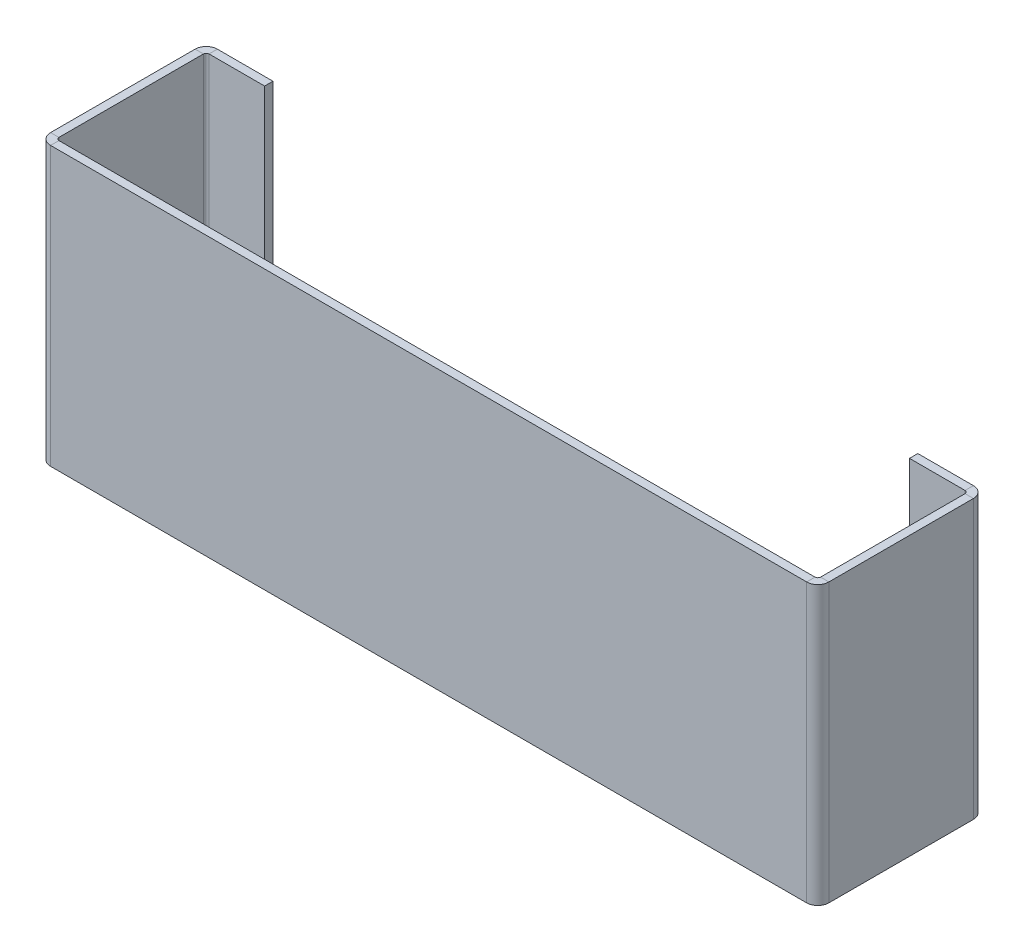
from build123d import *

# Parameters (mm, degrees)
BASE_FLANGE1_DEPTH = 50


# Sheet-metal steps are written as plain solids
with BuildPart() as part:
    # Sketch1 → Base-Flange1 (new body)
    with BuildSketch(Plane(origin=(0, 0, 0), x_dir=(1, 0, 0), z_dir=(0, 1, 0))):
        with BuildLine():
            Line((58, 30), (68, 30))
            ThreePointArc((68, 30), (69.414213562, 29.414213562), (70, 28))
            Line((70, 28), (70, 2))
            ThreePointArc((70, 2), (69.414213562, 0.585786438), (68, 0))
            Line((68, 0), (-68, 0))
            ThreePointArc((-68, 0), (-69.414213562, 0.585786438), (-70, 2))
            Line((-70, 2), (-70, 28))
            ThreePointArc((-70, 28), (-69.414213562, 29.414213562), (-68, 30))
            Line((-68, 30), (-58, 30))
            Line((-58, 30), (-58, 28.5))
            Line((-58, 28.5), (-68, 28.5))
            ThreePointArc((-68, 28.5), (-68.353553391, 28.353553391), (-68.5, 28))
            Line((-68.5, 28), (-68.5, 2))
            ThreePointArc((-68.5, 2), (-68.353553391, 1.646446609), (-68, 1.5))
            Line((-68, 1.5), (68, 1.5))
            ThreePointArc((68, 1.5), (68.353553391, 1.646446609), (68.5, 2))
            Line((68.5, 2), (68.5, 28))
            ThreePointArc((68.5, 28), (68.353553391, 28.353553391), (68, 28.5))
            Line((68, 28.5), (58, 28.5))
            Line((58, 28.5), (58, 30))
        make_face()
    extrude(amount=BASE_FLANGE1_DEPTH)


solid = part.part
